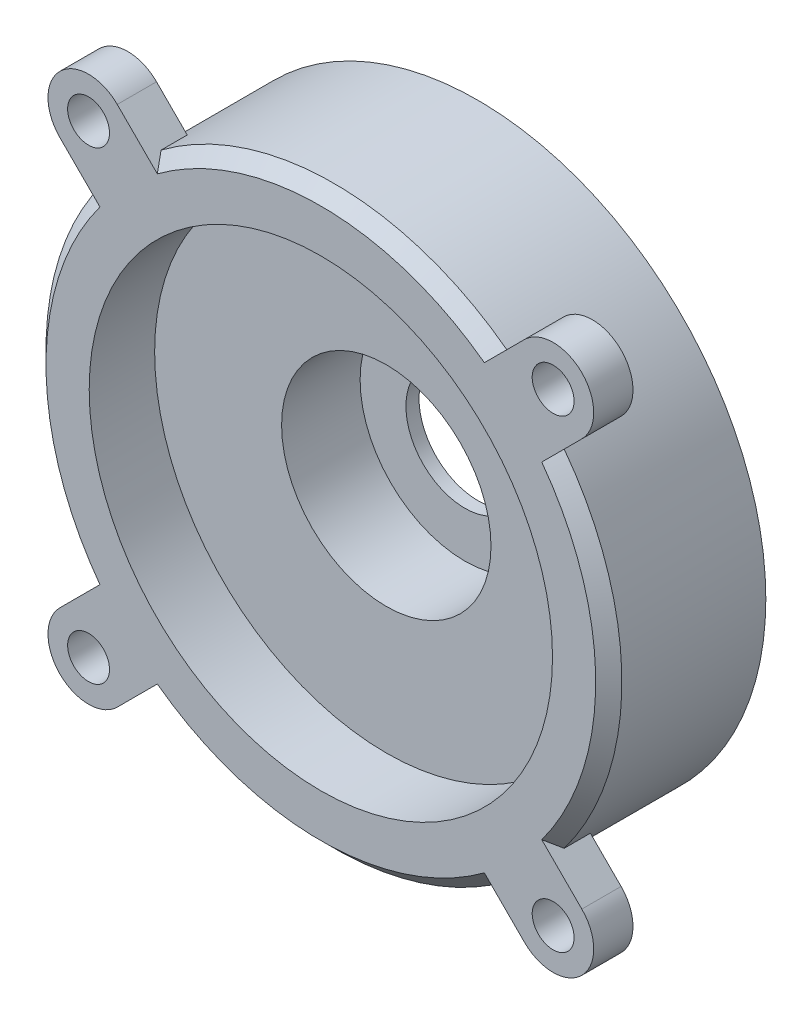
from build123d import *

# Parameters (mm, degrees)
SKETCH1_R           = 22
BOSS_EXTRUDE1_DEPTH = 6
CHAMFER1_SIZE       = 1
SKETCH8_R           = 1.6
BOSS_EXTRUDE2_DEPTH = 3
SKETCH9_R           = 17.7
CUT_EXTRUDE1_DEPTH  = 5
SKETCH10_R          = 8
CUT_EXTRUDE2_DEPTH  = 6
SKETCH11_R          = 4.5
CUT_EXTRUDE3_DEPTH  = 1


with BuildPart() as part:
    # Sketch1 → Boss-Extrude1 (new, symmetric)
    with BuildSketch(Plane.XY):
        Circle(SKETCH1_R)
    extrude(amount=BOSS_EXTRUDE1_DEPTH, both=True)

    # Chamfer1
    chamfer1_edges = [part.edges().sort_by_distance(p)[0] for p in [
        (-22, 0, 6),
    ]]
    chamfer(chamfer1_edges, length=CHAMFER1_SIZE)

    # Sketch8 → Boss-Extrude2 (add)
    # profile 1 of 4: a face of its own
    with BuildSketch(Plane.XY.offset(6)):
        with BuildLine():
            Line((15.556349186, 19.940411229), (12.494527459, 16.878589502))
            Line((12.494527459, 16.878589502), (16.878589502, 12.494527459))
            Line((16.878589502, 12.494527459), (19.940411229, 15.556349186))
            ThreePointArc((19.940411229, 15.556349186), (19.940411229, 19.940411229), (15.556349186, 19.940411229))
        make_face()
        with Locations((17.748380208, 17.748380208)):
            Circle(SKETCH8_R, mode=Mode.SUBTRACT)
    # profile 2 of 4: a face of its own
    with BuildSketch(Plane.XY.offset(6)):
        with BuildLine():
            Line((19.940411229, -15.556349186), (16.878589502, -12.494527459))
            Line((16.878589502, -12.494527459), (12.494527459, -16.878589502))
            Line((12.494527459, -16.878589502), (15.556349186, -19.940411229))
            ThreePointArc((15.556349186, -19.940411229), (19.940411229, -19.940411229), (19.940411229, -15.556349186))
        make_face()
        with Locations((17.748380208, -17.748380208)):
            Circle(SKETCH8_R, mode=Mode.SUBTRACT)
    # profile 3 of 4: a face of its own
    with BuildSketch(Plane.XY.offset(6)):
        with BuildLine():
            Line((-15.556349186, -19.940411229), (-12.494527459, -16.878589502))
            Line((-12.494527459, -16.878589502), (-16.878589502, -12.494527459))
            Line((-16.878589502, -12.494527459), (-19.940411229, -15.556349186))
            ThreePointArc((-19.940411229, -15.556349186), (-19.940411229, -19.940411229), (-15.556349186, -19.940411229))
        make_face()
        with Locations((-17.748380208, -17.748380208)):
            Circle(SKETCH8_R, mode=Mode.SUBTRACT)
    # profile 4 of 4: a face of its own
    with BuildSketch(Plane.XY.offset(6)):
        with BuildLine():
            Line((-19.940411229, 15.556349186), (-16.878589502, 12.494527459))
            Line((-16.878589502, 12.494527459), (-12.494527459, 16.878589502))
            Line((-12.494527459, 16.878589502), (-15.556349186, 19.940411229))
            ThreePointArc((-15.556349186, 19.940411229), (-19.940411229, 19.940411229), (-19.940411229, 15.556349186))
        make_face()
        with Locations((-17.748380208, 17.748380208)):
            Circle(SKETCH8_R, mode=Mode.SUBTRACT)
    extrude(amount=-BOSS_EXTRUDE2_DEPTH)

    # Sketch9 → Cut-Extrude1 (cut)
    with BuildSketch(Plane.XY.offset(6)):
        Circle(SKETCH9_R)
    extrude(amount=-CUT_EXTRUDE1_DEPTH, mode=Mode.SUBTRACT)

    # Sketch10 → Cut-Extrude2 (cut)
    with BuildSketch(Plane.XY.offset(1)):
        Circle(SKETCH10_R)
    extrude(amount=-CUT_EXTRUDE2_DEPTH, mode=Mode.SUBTRACT)

    # Sketch11 → Cut-Extrude3 (cut)
    with BuildSketch(Plane.XY.offset(-5)):
        Circle(SKETCH11_R)
    extrude(amount=-CUT_EXTRUDE3_DEPTH, mode=Mode.SUBTRACT)


solid = part.part
